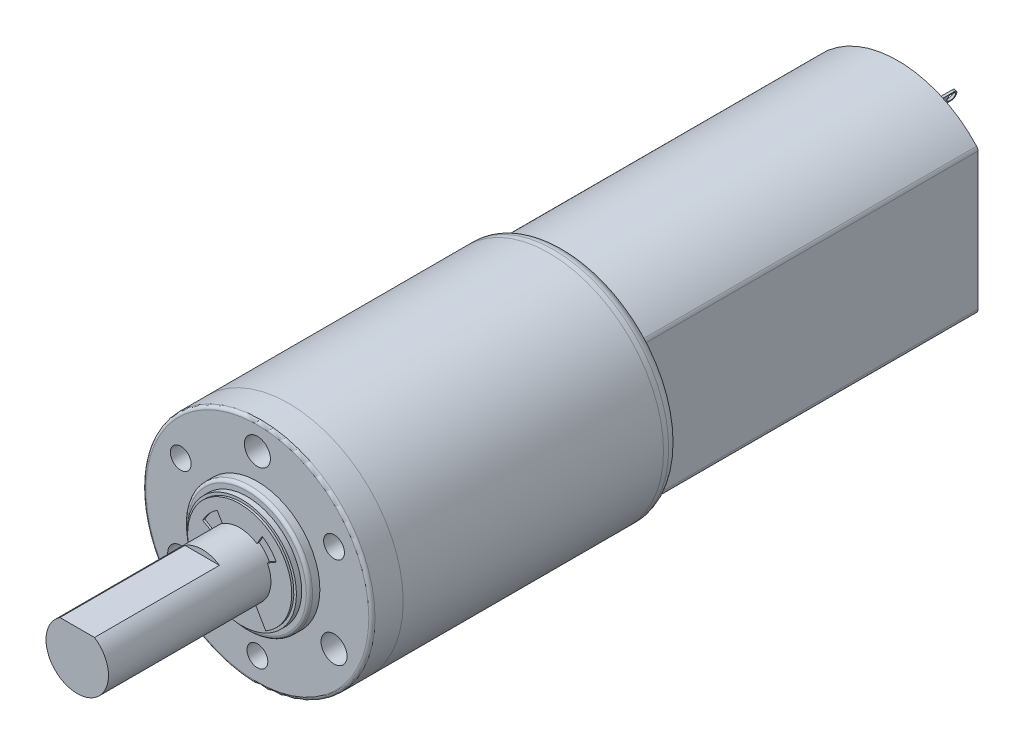
from build123d import *

# Parameters (mm, degrees)
SKETCH_1_R                       = 10.25
EXTRUDE_1_DEPTH                  = 32
CUT_EXTRUDE_1_DEPTH              = 36.130115286
CUT_EXTRUDE_1_DEPTH_BACK         = 36.130115286
SKETCH_3_R                       = 11
EXTRUDE_2_DEPTH                  = 1.5
SKETCH_4_R                       = 11
EXTRUDE_3_DEPTH                  = 25
SKETCH_5_R                       = 11
EXTRUDE_4_DEPTH                  = 3
SKETCH_6_R                       = 6
EXTRUDE_5_DEPTH                  = 1
FILLET_START                     = 32
FILLET_1_2_DEPTH                 = 1
FILLET_2_R                       = 0.3
FILLET_3_R                       = 0.5
SKETCH_7_R                       = 5.25
EXTRUDE_6_DEPTH                  = 0.5
SKETCH_8_R                       = 3
EXTRUDE_7_DEPTH                  = 15.8
CUT_EXTRUDE_2_DEPTH              = 12
EXTRUDE_8_DEPTH                  = 0.2
PATTERN_CIRCULAR_1_COUNT         = 3
SKETCH_15_R                      = 1
CUT_EXTRUDE_3_DEPTH              = 2
PATTERN_CIRCULAR_2_COUNT         = 3
CUT_EXTRUDE_4_DEPTH              = 1
SKETCH_24_R                      = 4
EXTRUDE_9_DEPTH                  = 3
SKETCH_25_R                      = 1
EXTRUDE_10_DEPTH                 = 1
FILLET_4_R                       = 0.25
FILLET_5_R                       = 0.1
SKETCH_26_R                      = 0.75
EXTRUDE_11_DEPTH                 = 0.3
EXTRUDE_12_DEPTH                 = 3.5
SKETCH_28_R                      = 0.4
CUT_EXTRUDE_5_DEPTH              = 81.338470066
FILLET_6_R                       = 0.4
PATTERN_CIRCULAR_7_COUNT         = 2
FILLET_6_OF_PATTERN_CIRCULAR_7_R = 0.4


with BuildPart() as part:
    # 草圖1 → 填料-伸長1 (new body)
    with BuildSketch(Plane.XY):
        Circle(SKETCH_1_R)
    extrude(amount=EXTRUDE_1_DEPTH)

    # 草圖2 → 除料-伸長1 (cut, two sides: drawn at the far end of the back side and taken through both)
    with BuildSketch(Plane.XY.offset(32).offset(-CUT_EXTRUDE_1_DEPTH_BACK)):
        with BuildLine():
            Line((-7.7, -6.765537673), (-7.7, 6.765537673))
            ThreePointArc((-7.7, 6.765537673), (-10.25, 0), (-7.7, -6.765537673))
        make_face()
        with BuildLine():
            ThreePointArc((10.25, 0), (9.591337237, 3.615072613), (7.7, 6.765537673))
            Line((7.7, 6.765537673), (7.7, -6.765537673))
            ThreePointArc((7.7, -6.765537673), (9.591337237, -3.615072613), (10.25, 0))
        make_face()
    extrude(amount=CUT_EXTRUDE_1_DEPTH + CUT_EXTRUDE_1_DEPTH_BACK, mode=Mode.SUBTRACT)

    # 草圖3 → 填料-伸長2 (add)
    with BuildSketch(Plane.XY.offset(32)):
        Circle(SKETCH_3_R)
    extrude(amount=EXTRUDE_2_DEPTH)

    # 圓角1: read off the stored shape, not the designer's step
    # 圓角1 outline → 圓角1 (revolve, cut)
    with BuildSketch(Plane.XZ):
        with BuildLine():
            ThreePointArc((11, 33), (10.707106781, 32.292893219), (10, 32))
            Line((10, 32), (11, 32))
            Line((11, 32), (11, 33))
        make_face()
    revolve(axis=Axis((0, 0, 0), (0, 0, 1)), mode=Mode.SUBTRACT)

    # Fillet 1 2 outline → Fillet 1 2 (add)
    with BuildSketch(Plane.XY.offset(FILLET_START)):
        with BuildLine():
            ThreePointArc((7.7, 6.765537673), (0, 10.25), (-7.7, 6.765537673))
            Line((-7.7, 6.765537673), (-7.7, -6.765537673))
            ThreePointArc((-7.7, -6.765537673), (0, -10.25), (7.7, -6.765537673))
            Line((7.7, -6.765537673), (7.7, 6.765537673))
        make_face()
    extrude(amount=FILLET_1_2_DEPTH)

    # 圓角3
    fillet_3_edges = [part.edges().sort_by_distance(p)[0] for p in [
        (-7.7, 6.765537673, 16),
        (-7.7, -6.765537673, 16),
        (7.7, -6.765537673, 16),
        (7.7, 6.765537673, 16),
    ]]
    fillet(fillet_3_edges, radius=FILLET_3_R)

    # 草圖23 → 除料-伸長4 (cut)
    with BuildSketch(Plane(origin=(0, 0, 0), x_dir=(-1, 0, 0), z_dir=(0, 0, -1))):
        with BuildLine():
            Line((-7.375, 6.498628393), (-7.375, -6.498628393))
            ThreePointArc((-7.375, -6.498628393), (0, -9.829689516), (7.375, -6.498628393))
            Line((7.375, -6.498628393), (7.375, 6.498628393))
            ThreePointArc((7.375, 6.498628393), (0, 9.829689516), (-7.375, 6.498628393))
        make_face()
    extrude(amount=-CUT_EXTRUDE_4_DEPTH, mode=Mode.SUBTRACT)

    # 草圖24 → 填料-伸長9 (add)
    with BuildSketch(Plane(origin=(0, 0, 1), x_dir=(-1, 0, 0), z_dir=(0, 0, -1))):
        Circle(SKETCH_24_R)
    extrude(amount=EXTRUDE_9_DEPTH)

    # 草圖25 → 填料-伸長10 (add)
    with BuildSketch(Plane(origin=(0, 0, -2), x_dir=(-1, 0, 0), z_dir=(0, 0, -1))):
        Circle(SKETCH_25_R)
    extrude(amount=EXTRUDE_10_DEPTH)

    # 圓角4
    fillet_4_edges = [part.edges().sort_by_distance(p)[0] for p in [
        (4, 0, -2),
    ]]
    fillet(fillet_4_edges, radius=FILLET_4_R)

    # 圓角5
    fillet_5_edges = [part.edges().sort_by_distance(p)[0] for p in [
        (1, 0, -3),
    ]]
    fillet(fillet_5_edges, radius=FILLET_5_R)

    # 草圖26 → 填料-伸長11 (add)
    with BuildSketch(Plane(origin=(0, 0, 1), x_dir=(-1, 0, 0), z_dir=(0, 0, -1))):
        with Locations((-2.736161147, 7.517540966)):
            Circle(SKETCH_26_R)
    extrude_11 = extrude(amount=EXTRUDE_11_DEPTH)

    # 草圖27 → 填料-伸長12 (add)
    with BuildSketch(Plane(origin=(0, 0, 0.7), x_dir=(-1, 0, 0), z_dir=(0, 0, -1))):
        Polygon((-3.00114048, 7.953185262), (-2.659120337, 7.013492642), (-2.471181813, 7.08189667), (-2.813201956, 8.021589291), align=None)
    extrude_12 = extrude(amount=EXTRUDE_12_DEPTH)

    # 草圖28 → 除料-伸長5 (cut, through all)
    with BuildSketch(Plane(origin=(0.093969262, -0.034202014, 0), x_dir=(0, 0, -1), z_dir=(0.9396926207859105, -0.3420201433256633, 0))):
        with Locations(Location((2.3, 8, 0), (0, 0, 90))):
            Circle(SKETCH_28_R)
    cut_extrude_5 = extrude(amount=-CUT_EXTRUDE_5_DEPTH, mode=Mode.SUBTRACT)

    # 圓角6
    fillet_6_edges = [part.edges().sort_by_distance(p)[0] for p in [
        (2.907171218, 7.987387277, -2.8),
        (2.565151075, 7.047694656, -2.8),
    ]]
    fillet(fillet_6_edges, radius=FILLET_6_R)

    # 環狀複製排列7: 填料-伸長11, 填料-伸長12, 除料-伸長5 ×2 about axis
    pattern_circular_7_axis = Axis((0, 0, 0), (0, 0, 1))
    add([extrude_11.rotate(pattern_circular_7_axis, i * 360 / PATTERN_CIRCULAR_7_COUNT) for i in range(1, PATTERN_CIRCULAR_7_COUNT)])
    add([extrude_12.rotate(pattern_circular_7_axis, i * 360 / PATTERN_CIRCULAR_7_COUNT) for i in range(1, PATTERN_CIRCULAR_7_COUNT)])
    add([cut_extrude_5.rotate(pattern_circular_7_axis, i * 360 / PATTERN_CIRCULAR_7_COUNT) for i in range(1, PATTERN_CIRCULAR_7_COUNT)], mode=Mode.SUBTRACT)

    # 圓角6 of 環狀複製排列7
    fillet_6_of_pattern_circular_7_edges = [part.edges().sort_by_distance(p)[0] for p in [
        (-2.907171218, -7.987387277, -2.8),
        (-2.565151075, -7.047694656, -2.8),
    ]]
    fillet(fillet_6_of_pattern_circular_7_edges, radius=FILLET_6_OF_PATTERN_CIRCULAR_7_R)


with BuildPart() as body_2:
    # 草圖4 → 填料-伸長3 (new body)
    with BuildSketch(Plane.XY.offset(33.5)):
        Circle(SKETCH_4_R)
    extrude(amount=EXTRUDE_3_DEPTH)


with BuildPart() as body_3:
    # 草圖5 → 填料-伸長4 (new body)
    with BuildSketch(Plane.XY.offset(58.5)):
        Circle(SKETCH_5_R)
    extrude(amount=EXTRUDE_4_DEPTH)

    # 草圖6 → 填料-伸長5 (add)
    with BuildSketch(Plane.XY.offset(61.5)):
        Circle(SKETCH_6_R)
    extrude(amount=EXTRUDE_5_DEPTH)

    # 圓角2
    fillet_2_edges = [body_3.edges().sort_by_distance(p)[0] for p in [
        (-11, 0, 61.5),
        (-6, 0, 62.5),
    ]]
    fillet(fillet_2_edges, radius=FILLET_2_R)

    # 草圖7 → 填料-伸長6 (add)
    with BuildSketch(Plane.XY.offset(62.5)):
        Circle(SKETCH_7_R)
    extrude(amount=EXTRUDE_6_DEPTH)

    # 草圖8 → 填料-伸長7 (add)
    with BuildSketch(Plane.XY.offset(63)):
        Circle(SKETCH_8_R)
    extrude(amount=EXTRUDE_7_DEPTH)

    # 草圖9 → 除料-伸長2 (cut)
    with BuildSketch(Plane.XY.offset(78.8)):
        with BuildLine():
            Line((-1.658312395, 2.5), (1.658312395, 2.5))
            ThreePointArc((1.658312395, 2.5), (0, 3), (-1.658312395, 2.5))
        make_face()
    extrude(amount=-CUT_EXTRUDE_2_DEPTH, mode=Mode.SUBTRACT)

    # 草圖10 → 填料-伸長8 (add)
    with BuildSketch(Plane.XY.offset(63)):
        with BuildLine():
            Line((-2.5, -4.330127019), (-1.5, -2.598076211))
            ThreePointArc((-1.5, -2.598076211), (-2.872281323, -0.866025404), (-2.686140662, 1.335907312))
            Line((-2.686140662, 1.335907312), (-3.552166065, 1.835907312))
            ThreePointArc((-3.552166065, 1.835907312), (-2.955961165, 2.692718516), (-2.158312395, 3.366025404))
            Line((-2.158312395, 3.366025404), (-1.658312395, 2.5))
            ThreePointArc((-1.658312395, 2.5), (0, 3), (1.658312395, 2.5))
            Line((1.658312395, 2.5), (2.158312395, 3.366025404))
            ThreePointArc((2.158312395, 3.366025404), (2.934096825, 2.716526318), (3.52202007, 1.893096416))
            Line((3.52202007, 1.893096416), (2.655994666, 1.393096416))
            ThreePointArc((2.655994666, 1.393096416), (2.880649779, -0.834794671), (1.499585384, -2.597358075))
            Line((1.499585384, -2.597358075), (2.5, -4.330127019))
            ThreePointArc((2.5, -4.330127019), (0, 5), (-2.5, -4.330127019))
        make_face()
    extrude(amount=EXTRUDE_8_DEPTH)


with BuildPart() as m3x0_5_1_tool:
    # 草圖14 → M3x0.5 螺紋孔1 (revolve)
    with BuildSketch(Plane(origin=(0, 8.5, 61.5), x_dir=(0, -1, 0), z_dir=(1, 0, 0))):
        Polygon((0, 0), (0, 4.751075774), (1.25, 4), (1.25, 0), align=None)
    m3x0_5_1 = revolve(axis=Axis((0, 8.5, 67.85), (0, 0, -1)))


with BuildPart() as body_2_1:
    add(body_2.part)

    # M3x0.5 螺紋孔1: cut by m3x0_5_1_tool
    add(m3x0_5_1_tool.part, mode=Mode.SUBTRACT)


with BuildPart() as body_3_1:
    add(body_3.part)

    # M3x0.5 螺紋孔1: cut by m3x0_5_1_tool
    add(m3x0_5_1_tool.part, mode=Mode.SUBTRACT)


with BuildPart() as pattern_circular_1_tool:
    # 環狀複製排列1: M3x0.5 螺紋孔1 ×3 about axis
    pattern_circular_1_axis = Axis((0, 0, 0), (0, 0, 1))
    for i in range(1, PATTERN_CIRCULAR_1_COUNT):
        add(m3x0_5_1.rotate(pattern_circular_1_axis, i * 360 / PATTERN_CIRCULAR_1_COUNT))


with BuildPart() as body_2_2:
    add(body_2_1.part)

    # 環狀複製排列1: cut by pattern_circular_1_tool
    add(pattern_circular_1_tool.part, mode=Mode.SUBTRACT)


with BuildPart() as body_3_2:
    add(body_3_1.part)

    # 環狀複製排列1: cut by pattern_circular_1_tool
    add(pattern_circular_1_tool.part, mode=Mode.SUBTRACT)

    # 草圖15 → 除料-伸長3 (cut)
    with BuildSketch(Plane.XY.offset(61.5)):
        with Locations((0, -8.5)):
            Circle(SKETCH_15_R)
    cut_extrude_3 = extrude(amount=-CUT_EXTRUDE_3_DEPTH, mode=Mode.SUBTRACT)

    # 環狀複製排列2: 除料-伸長3 ×3 about axis
    pattern_circular_2_axis = Axis((0, 0, 0), (0, 0, 1))
    for i in range(1, PATTERN_CIRCULAR_2_COUNT):
        add(cut_extrude_3.rotate(pattern_circular_2_axis, i * 360 / PATTERN_CIRCULAR_2_COUNT), mode=Mode.SUBTRACT)


solid = Compound([part.part, body_2_2.part, body_3_2.part])
